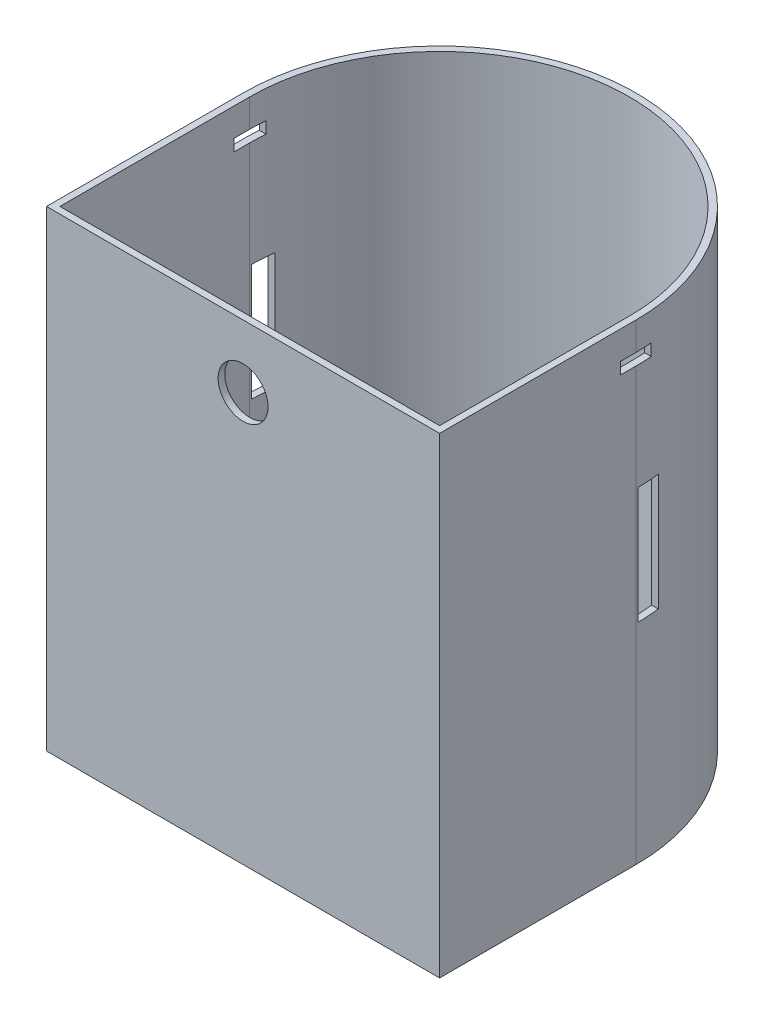
from build123d import *

# Parameters (mm, degrees)
BOSS_EXTRUDE1_DEPTH = 120
CUT_EXTRUDE1_DEPTH  = 118
SKETCH18_R          = 6.35
CUT_EXTRUDE9_DEPTH  = 8
CUT_EXTRUDE10_START = -2
CUT_EXTRUDE10_DEPTH = 2
BOSS_EXTRUDE2_DEPTH = 48
CHAMFER1_SIZE       = 2
CHAMFER1_SIZE2      = 7.464101615
SKETCH20_W          = 5.5
SKETCH20_H          = 29.700000001
SKETCH20_W_2        = 8
SKETCH20_H_2        = 3
CUT_EXTRUDE11_DEPTH = 165.012194669


# Read off the part's stored shape, not the designer's step: Cut-Extrude10, Boss-Extrude2
with BuildPart() as part:
    # Sketch2 → Boss-Extrude1 (new body)
    with BuildSketch(Plane(origin=(0, 0, 0), x_dir=(1, 0, 0), z_dir=(0, 1, 0))):
        with BuildLine():
            Line((-50, 0), (-50, -50))
            Line((-50, -50), (50, -50))
            Line((50, -50), (50, 0))
            ThreePointArc((50, 0), (0, 50), (-50, 0))
        make_face()
    extrude(amount=BOSS_EXTRUDE1_DEPTH)

    # Sketch3 → Cut-Extrude1 (cut)
    with BuildSketch(Plane(origin=(0, 120, 0), x_dir=(1, 0, 0), z_dir=(0, 1, 0))):
        with BuildLine():
            Line((-48.3, 0), (-48.3, -48.3))
            Line((-48.3, -48.3), (48.3, -48.3))
            Line((48.3, -48.3), (48.3, 0))
            ThreePointArc((48.3, 0), (0, 48.3), (-48.3, 0))
        make_face()
    extrude(amount=-CUT_EXTRUDE1_DEPTH, mode=Mode.SUBTRACT)

    # Sketch18 → Cut-Extrude9 (cut)
    with BuildSketch(Plane.XY.offset(50)):
        with Locations((0, 104)):
            Circle(SKETCH18_R)
    extrude(amount=-CUT_EXTRUDE9_DEPTH, mode=Mode.SUBTRACT)

    # Cut-Extrude10 outline → Cut-Extrude10 (cut)
    with BuildSketch(Plane(origin=(0, 2, 0), x_dir=(1, 0, 0), z_dir=(0, 1, 0)).offset(CUT_EXTRUDE10_START)):
        Polygon((12.2, 16.55), (12.2, 21.3), (9.282585541, 21.3), (9.282585541, 22.3), (11.241292771, 22.3), (11.241292771, 29.388121527), (13.2, 29.388121527), (13.2, 40.3), (-13.2, 40.3), (-13.2, 29.388121527), (-11.241292771, 29.388121527), (-11.241292771, 22.3), (-9.282585541, 22.3), (-9.282585541, 21.3), (-12.2, 21.3), (-12.2, 16.55), align=None)
    extrude(amount=CUT_EXTRUDE10_DEPTH, mode=Mode.SUBTRACT)

    # Boss-Extrude2 outline → Boss-Extrude2 (add)
    with BuildSketch(Plane(origin=(0, 2, 0), x_dir=(1, 0, 0), z_dir=(0, 1, 0))):
        Polygon((9.282585541, 21.3), (12.2, 21.3), (12.2, 16.55), (9.282585541, 16.55), (9.282585541, 15.55), (13.2, 15.55), (13.2, 22.3), (9.282585541, 22.3), align=None)
        Polygon((-9.282585541, 15.55), (-9.282585541, 16.55), (-12.2, 16.55), (-12.2, 21.3), (-9.282585541, 21.3), (-9.282585541, 22.3), (-13.2, 22.3), (-13.2, 15.55), align=None)
    extrude(amount=BOSS_EXTRUDE2_DEPTH)

    # Chamfer1
    chamfer1_edges = [part.edges().sort_by_distance(p)[0] for p in [
        (13.2, 2, -18.925),
        (11.24129277, 2, -15.55),
        (-13.2, 2, -18.925),
        (-11.24129277, 2, -15.55),
    ]]
    chamfer1_side = [part.faces().sort_by_distance(p)[0] for p in [
        (0, 2, 7.094220812),
    ]]
    chamfer(chamfer1_edges, length=CHAMFER1_SIZE, length2=CHAMFER1_SIZE2, reference=chamfer1_side[0])

    # Sketch20 → Cut-Extrude11 (cut, through all)
    with BuildSketch(Plane(origin=(50, 0, 0), x_dir=(0, 0, -1), z_dir=(1, 0, 0))):
        with Locations((3.25, 67.984146729)):
            Rectangle(SKETCH20_W, SKETCH20_H)
        with Locations((0, 111.353074805)):
            Rectangle(SKETCH20_W_2, SKETCH20_H_2)
    extrude(amount=-CUT_EXTRUDE11_DEPTH, mode=Mode.SUBTRACT)


solid = part.part
